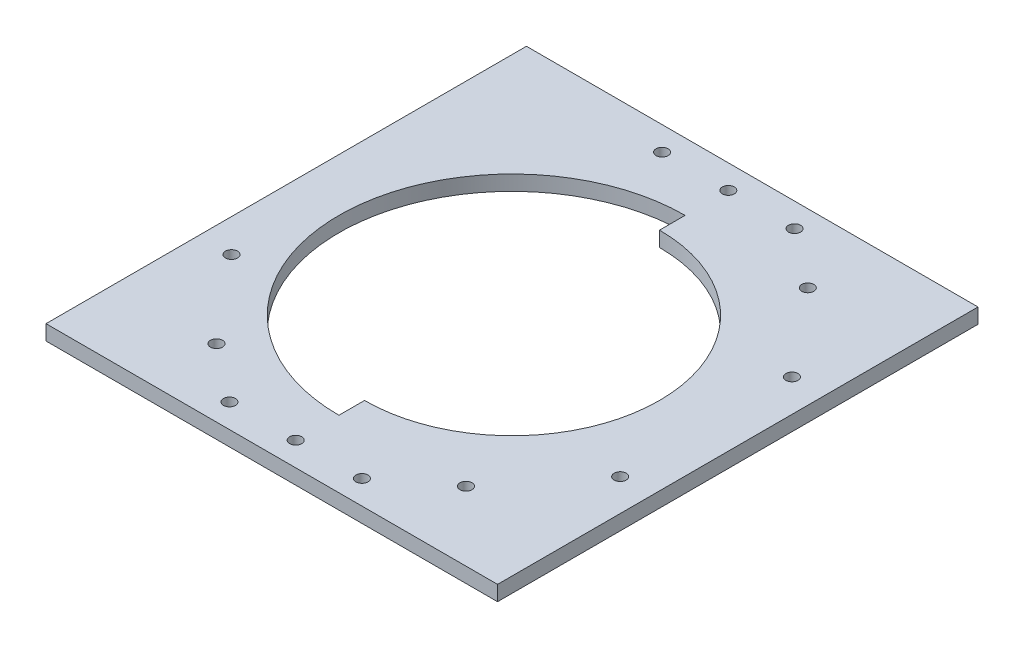
from build123d import *

# Parameters (mm, degrees)
SKETCH1_W               = 150
SKETCH1_H               = 159.6
SKETCH1_R               = 49
SKETCH1_R_2             = 2
BOSS_EXTRUDE1_DEPTH     = 5
CUT_EXTRUDE2_DEPTH      = 361.668053747
CUT_EXTRUDE2_DEPTH_BACK = 361.668053747
SKETCH2_R               = 2
CUT_EXTRUDE3_DEPTH      = 361.668053747
CUT_EXTRUDE3_DEPTH_BACK = 361.668053747


with BuildPart() as part:
    # Sketch1 → Boss-Extrude1 (new body)
    with BuildSketch(Plane(origin=(0, 0, 0), x_dir=(1, 0, 0), z_dir=(0, 1, 0))):
        with Locations((-266.66296023, 35.624722657)):
            Rectangle(SKETCH1_W, SKETCH1_H)
        with Locations((-266.66296023, 35.624722657)):
            Circle(SKETCH1_R, mode=Mode.SUBTRACT)
        with Locations((-288.66296023, 107.480688217)):
            Circle(SKETCH1_R_2, mode=Mode.SUBTRACT)
        with Locations((-244.66296023, 107.480688217)):
            Circle(SKETCH1_R_2, mode=Mode.SUBTRACT)
        with Locations((-244.66296023, -36.231242903)):
            Circle(SKETCH1_R_2, mode=Mode.SUBTRACT)
        with Locations((-266.66296023, -36.231242903)):
            Circle(SKETCH1_R_2, mode=Mode.SUBTRACT)
        with Locations((-288.66296023, -36.231242903)):
            Circle(SKETCH1_R_2, mode=Mode.SUBTRACT)
        with Locations((-266.66296023, 107.480688217)):
            Circle(SKETCH1_R_2, mode=Mode.SUBTRACT)
    extrude(amount=BOSS_EXTRUDE1_DEPTH)

    # Sketch2 → Cut-Extrude2 (cut, two sides: drawn at the far end of the back side and taken through both)
    with BuildSketch(Plane(origin=(0, 5, 0), x_dir=(1, 0, 0), z_dir=(0, 1, 0)).offset(-CUT_EXTRUDE2_DEPTH_BACK)):
        with Locations((-330.726221014, 6.506227376)):
            Circle(SKETCH2_R)
        with Locations((-307.584123877, -21.624264368)):
            Circle(SKETCH2_R)
        with Locations((-225.427493021, 92.647739007)):
            Circle(SKETCH2_R)
        with Locations((-202.440489915, 64.390369812)):
            Circle(SKETCH2_R)
        with Locations((-225.134601145, -21.185342836)):
            Circle(SKETCH2_R)
        with Locations((-202.293313539, 7.189942291)):
            Circle(SKETCH2_R)
    extrude(amount=CUT_EXTRUDE2_DEPTH + CUT_EXTRUDE2_DEPTH_BACK, mode=Mode.SUBTRACT)

    # Sketch3 → Cut-Extrude3 (cut, two sides: drawn at the far end of the back side and taken through both)
    with BuildSketch(Plane(origin=(0, 5, 0), x_dir=(1, 0, 0), z_dir=(0, 1, 0)).offset(-CUT_EXTRUDE3_DEPTH_BACK)):
        with BuildLine():
            Line((-266.66296023, 93.124722657), (-266.66296023, -21.875277343))
            ThreePointArc((-266.66296023, -21.875277343), (-324.16296023, 35.624722657), (-266.66296023, 93.124722657))
        make_face()
    extrude(amount=CUT_EXTRUDE3_DEPTH + CUT_EXTRUDE3_DEPTH_BACK, mode=Mode.SUBTRACT)


solid = part.part
